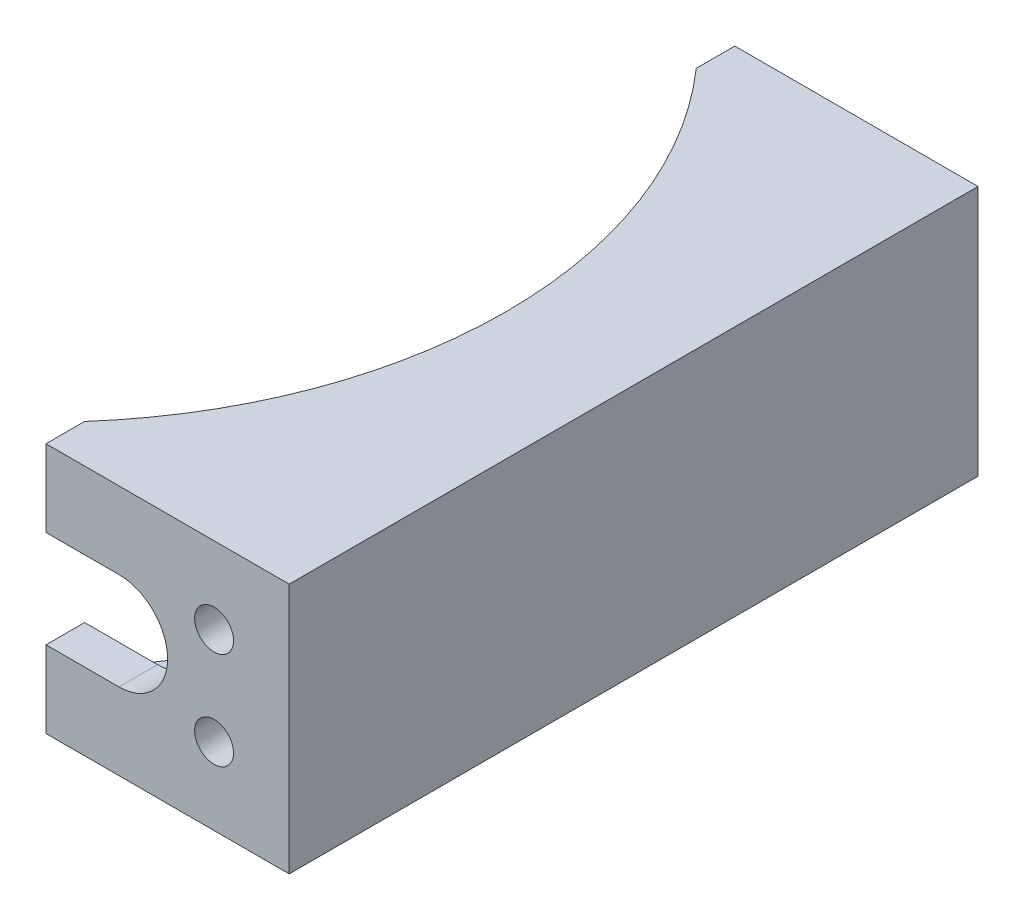
from build123d import *

# Parameters (mm, degrees)
BOSS_EXTRUDE1_DEPTH = 3.175
SKETCH2_W           = 3.175
SKETCH2_H           = 50.3
BOSS_EXTRUDE2_DEPTH = 14.29
SKETCH3_R           = 1.6
BOSS_EXTRUDE3_DEPTH = 3.175


with BuildPart() as part:
    # Sketch1 → Boss-Extrude1 (new body)
    with BuildSketch(Plane(origin=(0, 0, 0), x_dir=(1, 0, 0), z_dir=(0, 1, 0))):
        with BuildLine():
            Line((0, 0), (20, 0))
            Line((20, 0), (20, -50.3))
            Line((20, -50.3), (0, -50.3))
            ThreePointArc((0, -50.3), (9.513555855, -25.15), (0, 0))
        make_face()
    boss_extrude1 = extrude(amount=BOSS_EXTRUDE1_DEPTH)

    # Sketch2 → Boss-Extrude2 (add)
    with BuildSketch(Plane(origin=(0, 3.175, 0), x_dir=(1, 0, 0), z_dir=(0, 1, 0))):
        with Locations((18.4125, -25.15)):
            Rectangle(SKETCH2_W, SKETCH2_H)
    extrude(amount=BOSS_EXTRUDE2_DEPTH)

    # Mirror1: Boss-Extrude1 across plane
    add(boss_extrude1.mirror(Plane.ZX.offset(10.32)))

    # Sketch3 → Boss-Extrude3 (add)
    with BuildSketch(Plane(origin=(0, 0, 0), x_dir=(-1, 0, 0), z_dir=(0, 0, -1))):
        with BuildLine():
            Line((-20, 0), (0, 0))
            Line((0, 0), (0, 6.32))
            Line((0, 6.32), (-6, 6.32))
            ThreePointArc((-6, 6.32), (-10, 10.32), (-6, 14.32))
            Line((-6, 14.32), (0, 14.32))
            Line((0, 14.32), (0, 20.64))
            Line((0, 20.64), (-20, 20.64))
            Line((-20, 20.64), (-20, 0))
        make_face()
        with Locations((-13.825, 6.32)):
            Circle(SKETCH3_R, mode=Mode.SUBTRACT)
        with Locations((-13.825, 14.32)):
            Circle(SKETCH3_R, mode=Mode.SUBTRACT)
    boss_extrude3 = extrude(amount=BOSS_EXTRUDE3_DEPTH)

    # Mirror2: Boss-Extrude3 across plane
    add(boss_extrude3.mirror(Plane.XY.offset(25.15)))


solid = part.part
